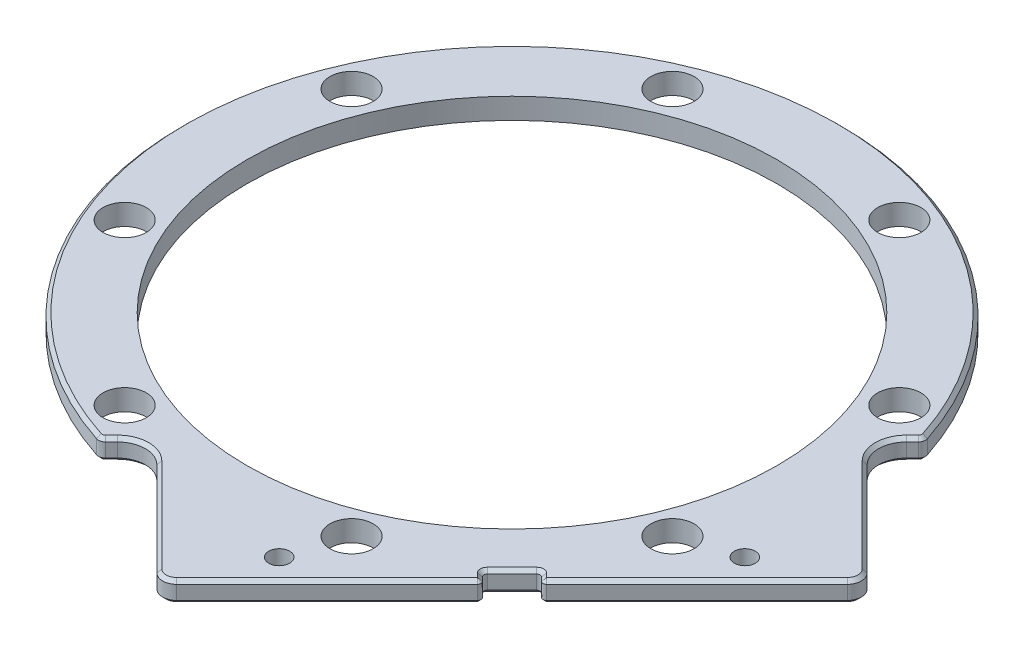
from build123d import *

# Parameters (mm, degrees)
SKETCH_1_R               = 47.25
SKETCH_1_R_2             = 38
SKETCH_1_R_3             = 3.1
EXTRUDE_1_DEPTH          = 3
CUT_EXTRUDE_1_DEPTH      = 67.888900425
CUT_EXTRUDE_1_DEPTH_BACK = 67.888900425
EXTRUDE_2_DEPTH          = 3
FILLET_1_R               = 1
CUT_EXTRUDE_2_DEPTH      = 82.883401917
CUT_EXTRUDE_2_DEPTH_BACK = 82.883401917
FILLET_2_R               = 0.5
CHAMFER_1_SIZE           = 0.5
CUT_EXTRUDE_3_DEPTH      = 82.883401775
CUT_EXTRUDE_3_DEPTH_BACK = 82.883401775
SKETCH_7_R               = 1.5
CUT_EXTRUDE_4_DEPTH      = 82.883401775
CUT_EXTRUDE_4_DEPTH_BACK = 82.883401775
SKETCH_8_R               = 1.5


with BuildPart() as part:
    # 草图1 → 凸台-拉伸1 (new body)
    with BuildSketch(Plane(origin=(0, 0, 0), x_dir=(1, 0, 0), z_dir=(0, 1, 0))):
        with Locations(Location((0, 0, 0), (0, 0, 270))):
            Circle(SKETCH_1_R)
        with Locations(Location((0, 0, 0), (0, 0, 270))):
            Circle(SKETCH_1_R_2, mode=Mode.SUBTRACT)
        with Locations(Location((-16.264045876, 39.264880132, 0), (0, 0, 270))):
            Circle(SKETCH_1_R_3, mode=Mode.SUBTRACT)
        with Locations(Location((16.264045876, 39.264880132, 0), (0, 0, 270))):
            Circle(SKETCH_1_R_3, mode=Mode.SUBTRACT)
        with Locations(Location((39.264880132, 16.264045876, 0), (0, 0, 270))):
            Circle(SKETCH_1_R_3, mode=Mode.SUBTRACT)
        with Locations(Location((39.264880132, -16.264045876, 0), (0, 0, 270))):
            Circle(SKETCH_1_R_3, mode=Mode.SUBTRACT)
        with Locations(Location((16.264045876, -39.264880132, 0), (0, 0, 270))):
            Circle(SKETCH_1_R_3, mode=Mode.SUBTRACT)
        with Locations(Location((-16.264045876, -39.264880132, 0), (0, 0, 270))):
            Circle(SKETCH_1_R_3, mode=Mode.SUBTRACT)
        with Locations(Location((-39.264880132, -16.264045876, 0), (0, 0, 270))):
            Circle(SKETCH_1_R_3, mode=Mode.SUBTRACT)
        with Locations(Location((-39.264880132, 16.264045876, 0), (0, 0, 270))):
            Circle(SKETCH_1_R_3, mode=Mode.SUBTRACT)
    extrude(amount=EXTRUDE_1_DEPTH)

    # 草图4 → 切除-拉伸1 (cut, two sides: drawn at the far end of the back side and taken through both)
    with BuildSketch(Plane(origin=(0, 3, 0), x_dir=(1, 0, 0), z_dir=(0, 1, 0)).offset(-CUT_EXTRUDE_1_DEPTH_BACK)):
        with BuildLine():
            Line((43.840620434, 12.727922061), (44.719682329, 13.606983957))
            ThreePointArc((44.719682329, 13.606983957), (45.806880456, 15.618172507), (45.614922333, 17.896336511))
            Line((45.614922333, 17.896336511), (84.379499133, 11.829199362))
            Line((84.379499133, 11.829199362), (6.001901693, -69.182953765))
            Line((6.001901693, -69.182953765), (-17.896336511, -45.614922333))
            ThreePointArc((-17.896336511, -45.614922333), (-15.618172507, -45.806880456), (-13.606983957, -44.719682329))
            Line((-13.606983957, -44.719682329), (-12.727922061, -43.840620434))
            ThreePointArc((-12.727922061, -43.840620434), (-9.899494937, -42.669047558), (-7.071067812, -43.840620434))
            Line((-7.071067812, -43.840620434), (6.363961031, -57.275649276))
            ThreePointArc((6.363961031, -57.275649276), (7.778174593, -57.861435714), (9.192388155, -57.275649276))
            Line((9.192388155, -57.275649276), (57.275649276, -9.192388155))
            ThreePointArc((57.275649276, -9.192388155), (57.861435714, -7.778174593), (57.275649276, -6.363961031))
            Line((57.275649276, -6.363961031), (43.840620434, 7.071067812))
            ThreePointArc((43.840620434, 7.071067812), (42.669047558, 9.899494937), (43.840620434, 12.727922061))
        make_face()
    extrude(amount=CUT_EXTRUDE_1_DEPTH + CUT_EXTRUDE_1_DEPTH_BACK, mode=Mode.SUBTRACT)

    # 草图5 → 凸台-拉伸2 (add)
    with BuildSketch(Plane.XZ):
        with BuildLine():
            Line((57.275649276, 6.363961031), (43.840620434, -7.071067812))
            ThreePointArc((43.840620434, -7.071067812), (33.021886933, 33.021886933), (-7.071067812, 43.840620434))
            Line((-7.071067812, 43.840620434), (6.363961031, 57.275649276))
            ThreePointArc((6.363961031, 57.275649276), (7.778174593, 57.861435714), (9.192388155, 57.275649276))
            Line((9.192388155, 57.275649276), (57.275649276, 9.192388155))
            ThreePointArc((57.275649276, 9.192388155), (57.861435714, 7.778174593), (57.275649276, 6.363961031))
        make_face()
    extrude(amount=-EXTRUDE_2_DEPTH)

    # 圆角1
    fillet_1_edges = [part.edges().sort_by_distance(p)[0] for p in [
        (45.109607697, 1.5, -14.060078003),
        (-14.060078003, 1.5, 45.109607697),
    ]]
    fillet(fillet_1_edges, radius=FILLET_1_R)

    # 草图6 → 切除-拉伸2 (cut, two sides: drawn at the far end of the back side and taken through both)
    with BuildSketch(Plane.XZ.offset(-CUT_EXTRUDE_2_DEPTH_BACK)):
        Polygon((29.839906166, 34.082546853), (34.082546853, 29.839906166), (35.355339059, 31.112698372), (31.112698372, 35.355339059), align=None)
    extrude(amount=CUT_EXTRUDE_2_DEPTH + CUT_EXTRUDE_2_DEPTH_BACK, mode=Mode.SUBTRACT)

    # 圆角2
    fillet_2_edges = [part.edges().sort_by_distance(p)[0] for p in [
        (34.082546853, 1.5, 29.839906166),
        (31.112698372, 1.5, 35.355339059),
        (35.355339059, 1.5, 31.112698372),
        (29.839906166, 1.5, 34.082546853),
    ]]
    fillet(fillet_2_edges, radius=FILLET_2_R)

    # 倒角1
    chamfer_1_edges = [part.edges().sort_by_distance(p)[0] for p in [
        (57.861435714, 0, 7.778174593),
        (7.778174593, 0, 57.861435714),
        (7.778174593, 3, 57.861435714),
        (57.861435714, 3, 7.778174593),
        (-33.410795411, 3, -33.410795411),
        (-33.410795411, 0, -33.410795411),
        (44.267555216, 0, -13.154856844),
        (-14.055418364, 0, 44.959744811),
        (44.959744811, 0, -14.055418364),
        (44.267555216, 3, -13.154856844),
        (-14.055418364, 3, 44.959744811),
        (44.959744811, 3, -14.055418364),
        (34.718942956, 0, 30.476302269),
        (31.96122651, 0, 31.96122651),
        (30.476302269, 0, 34.718942956),
        (19.975766569, 0, 46.492270863),
        (30.905591591, 0, 35.355339059),
        (35.355339059, 0, 30.905591591),
        (34.718942956, 3, 30.476302269),
        (19.975766569, 3, 46.492270863),
        (30.476302269, 3, 34.718942956),
        (31.96122651, 3, 31.96122651),
        (30.905591591, 3, 35.355339059),
        (35.355339059, 3, 30.905591591),
        (34.082546853, 0, 30.047012947),
        (34.082546853, 3, 30.047012947),
        (30.047012947, 0, 34.082546853),
        (30.047012947, 3, 34.082546853),
        (-0.353553391, 3, 50.558134855),
        (46.492270863, 0, 19.975766569),
        (50.558134855, 3, -0.353553391),
        (-13.154856844, 0, 44.267555216),
        (-9.899494937, 0, 42.669047558),
        (-0.353553391, 0, 50.558134855),
        (46.492270863, 3, 19.975766569),
        (50.558134855, 0, -0.353553391),
        (42.669047558, 0, -9.899494937),
        (42.669047558, 3, -9.899494937),
        (-9.899494937, 3, 42.669047558),
        (-13.154856844, 3, 44.267555216),
    ]]
    chamfer(chamfer_1_edges, length=CHAMFER_1_SIZE - 0.0001)  # a hair under: the kernel refuses the full size

    # 草图7 → 切除-拉伸3 (cut, two sides: drawn at the far end of the back side and taken through both)
    with BuildSketch(Plane.XZ.offset(-CUT_EXTRUDE_3_DEPTH_BACK)):
        with Locations(Location((13.678623105, 47.053925479, 0), (0, 0, 270))):
            Circle(SKETCH_7_R)
    extrude(amount=CUT_EXTRUDE_3_DEPTH + CUT_EXTRUDE_3_DEPTH_BACK, mode=Mode.SUBTRACT)

    # 草图8 → 切除-拉伸4 (cut, two sides: drawn at the far end of the back side and taken through both)
    with BuildSketch(Plane.XZ.offset(-CUT_EXTRUDE_4_DEPTH_BACK)):
        with Locations(Location((47.053925479, 13.678623105, 0), (0, 0, 270))):
            Circle(SKETCH_8_R)
    extrude(amount=CUT_EXTRUDE_4_DEPTH + CUT_EXTRUDE_4_DEPTH_BACK, mode=Mode.SUBTRACT)


solid = part.part
